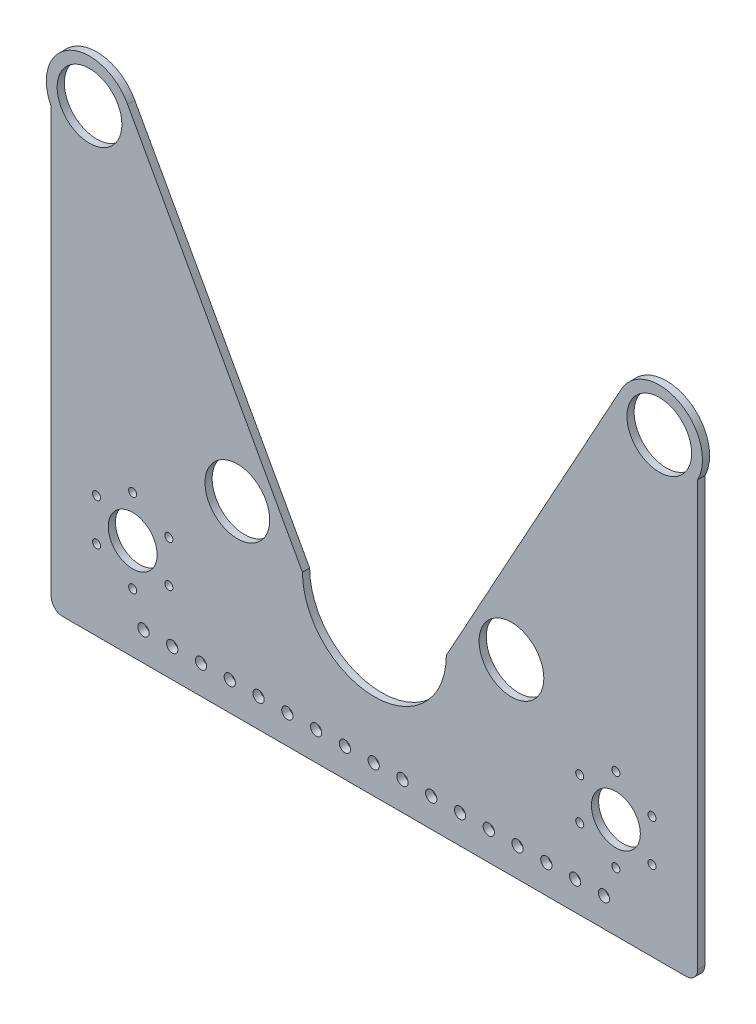
from build123d import *

# Parameters (mm, degrees)
SKETCH2_R           = 2.4892
SKETCH2_R_2         = 1.778
SKETCH2_R_3         = 10.795
SKETCH2_R_4         = 14.2875
BOSS_EXTRUDE1_DEPTH = 3.175


with BuildPart() as part:
    # Sketch2 → Boss-Extrude1 (new body)
    with BuildSketch(Plane.XY):
        with BuildLine():
            Line((-142.632381685, 122.462939957), (-142.632381685, -29.937060043))
            Line((-142.632381685, -29.937060043), (-142.632381685, -64.77))
            ThreePointArc((-142.632381685, -64.77), (-141.144484133, -68.362102448), (-137.552381685, -69.85))
            Line((-137.552381685, -69.85), (137.552381685, -69.85))
            ThreePointArc((137.552381685, -69.85), (141.144484133, -68.362102448), (142.632381685, -64.77))
            Line((142.632381685, -64.77), (142.632381685, -29.937060043))
            Line((142.632381685, -29.937060043), (142.632381685, 122.462939957))
            ThreePointArc((142.632381685, 122.462939957), (134.600001748, 148.101160684), (108.918256203, 140.209048469))
            Line((108.918256203, 140.209048469), (31.75, 0))
            ThreePointArc((31.75, 0), (0, -31.75), (-31.75, 0))
            Line((-31.75, 0), (-108.918256203, 140.209048469))
            ThreePointArc((-108.918256203, 140.209048469), (-134.600001748, 148.101160684), (-142.632381685, 122.462939957))
        make_face()
        with Locations((-101.9175, -57.15)):
            Circle(SKETCH2_R, mode=Mode.SUBTRACT)
        with Locations((-89.2175, -57.15)):
            Circle(SKETCH2_R, mode=Mode.SUBTRACT)
        with Locations((-76.5175, -57.15)):
            Circle(SKETCH2_R, mode=Mode.SUBTRACT)
        with Locations((-106.68, -43.815)):
            Circle(SKETCH2_R_2, mode=Mode.SUBTRACT)
        with Locations((-122.627857811, -34.6075)):
            Circle(SKETCH2_R_2, mode=Mode.SUBTRACT)
        with Locations((-122.627857811, -16.1925)):
            Circle(SKETCH2_R_2, mode=Mode.SUBTRACT)
        with Locations((-90.732142189, -34.6075)):
            Circle(SKETCH2_R_2, mode=Mode.SUBTRACT)
        with Locations((-106.68, -25.4)):
            Circle(SKETCH2_R_3, mode=Mode.SUBTRACT)
        with Locations((-90.732142189, -16.1925)):
            Circle(SKETCH2_R_2, mode=Mode.SUBTRACT)
        with Locations((-63.8175, -57.15)):
            Circle(SKETCH2_R, mode=Mode.SUBTRACT)
        with Locations((-51.1175, -57.15)):
            Circle(SKETCH2_R, mode=Mode.SUBTRACT)
        with Locations((-38.4175, -57.15)):
            Circle(SKETCH2_R, mode=Mode.SUBTRACT)
        with Locations((-25.7175, -57.15)):
            Circle(SKETCH2_R, mode=Mode.SUBTRACT)
        with Locations((-13.0175, -57.15)):
            Circle(SKETCH2_R, mode=Mode.SUBTRACT)
        with Locations((-0.3175, -57.15)):
            Circle(SKETCH2_R, mode=Mode.SUBTRACT)
        with Locations((-106.68, -6.985)):
            Circle(SKETCH2_R_2, mode=Mode.SUBTRACT)
        with Locations((-60.484532313, 12.7)):
            Circle(SKETCH2_R_4, mode=Mode.SUBTRACT)
        with Locations((12.3825, -57.15)):
            Circle(SKETCH2_R, mode=Mode.SUBTRACT)
        with Locations((25.0825, -57.15)):
            Circle(SKETCH2_R, mode=Mode.SUBTRACT)
        with Locations((37.7825, -57.15)):
            Circle(SKETCH2_R, mode=Mode.SUBTRACT)
        with Locations((50.4825, -57.15)):
            Circle(SKETCH2_R, mode=Mode.SUBTRACT)
        with Locations((63.1825, -57.15)):
            Circle(SKETCH2_R, mode=Mode.SUBTRACT)
        with Locations((75.8825, -57.15)):
            Circle(SKETCH2_R, mode=Mode.SUBTRACT)
        with Locations((88.5825, -57.15)):
            Circle(SKETCH2_R, mode=Mode.SUBTRACT)
        with Locations((101.2825, -57.15)):
            Circle(SKETCH2_R, mode=Mode.SUBTRACT)
        with Locations((106.564381685, -43.815)):
            Circle(SKETCH2_R_2, mode=Mode.SUBTRACT)
        with Locations((90.616523874, -34.6075)):
            Circle(SKETCH2_R_2, mode=Mode.SUBTRACT)
        with Locations((106.564381685, -25.4)):
            Circle(SKETCH2_R_3, mode=Mode.SUBTRACT)
        with Locations((90.616523874, -16.1925)):
            Circle(SKETCH2_R_2, mode=Mode.SUBTRACT)
        with Locations((122.512239495, -34.6075)):
            Circle(SKETCH2_R_2, mode=Mode.SUBTRACT)
        with Locations((122.512239495, -16.1925)):
            Circle(SKETCH2_R_2, mode=Mode.SUBTRACT)
        with Locations((60.484532313, 12.7)):
            Circle(SKETCH2_R_4, mode=Mode.SUBTRACT)
        with Locations((106.564381685, -6.985)):
            Circle(SKETCH2_R_2, mode=Mode.SUBTRACT)
        with Locations((-125.726814921, 131.243846084)):
            Circle(SKETCH2_R_4, mode=Mode.SUBTRACT)
        with Locations((125.726814921, 131.243846084)):
            Circle(SKETCH2_R_4, mode=Mode.SUBTRACT)
    extrude(amount=BOSS_EXTRUDE1_DEPTH)


solid = part.part
